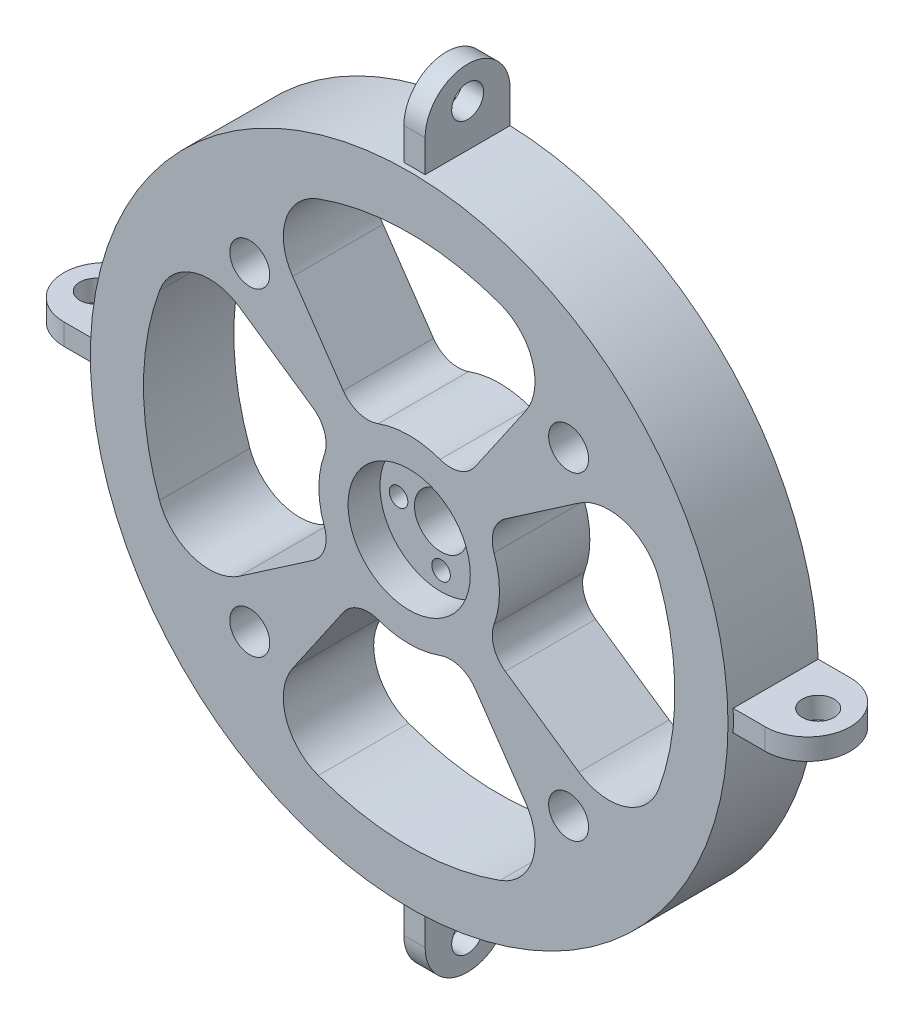
from build123d import *

# Parameters (mm, degrees)
SKETCH_1_R               = 60
EXTRUDE_1_DEPTH          = 17
SKETCH_2_R               = 3.76
CUT_EXTRUDE_1_DEPTH      = 87.539008545
EXTRUDE_2_DEPTH          = 2
SKETCH_4_R               = 3
CUT_EXTRUDE_7_DEPTH      = 99.025506885
CUT_EXTRUDE_3_REACH      = 98.773
SKETCH_5_R               = 5
SKETCH_6_R               = 11.5
CUT_EXTRUDE_4_DEPTH      = 6
CUT_EXTRUDE_5_REACH      = 97.901
SKETCH_7_R               = 1.75
CUT_EXTRUDE_6_REACH      = 98.773
PATTERN_CIRCULAR_3_COUNT = 4
PATTERN_CIRCULAR_4_COUNT = 4


with BuildPart() as part:
    # 草图1 → 凸台-拉伸1 (new body)
    with BuildSketch(Plane.XY):
        Circle(SKETCH_1_R)
    extrude(amount=EXTRUDE_1_DEPTH)

    # 草图2 → 切除-拉伸1 (cut, through all)
    with BuildSketch(Plane.XY.offset(17)):
        with Locations((-30, 30)):
            Circle(SKETCH_2_R)
        with Locations((30, 30)):
            Circle(SKETCH_2_R)
        with Locations((30, -30)):
            Circle(SKETCH_2_R)
        with Locations((-30, -30)):
            Circle(SKETCH_2_R)
    extrude(amount=-CUT_EXTRUDE_1_DEPTH, mode=Mode.SUBTRACT)

    # 草图3 → 凸台-拉伸2 (add, symmetric)
    with BuildSketch(Plane(origin=(0, 0, 0), x_dir=(0, 0, -1), z_dir=(1, 0, 0))):
        with BuildLine():
            Line((0, 58), (-16, 58))
            Line((-16, 58), (-16, 66))
            ThreePointArc((-16, 66), (-8, 74), (0, 66))
            Line((0, 66), (0, 58))
        make_face()
    extrude_2 = extrude(amount=EXTRUDE_2_DEPTH, both=True)

    # 草图4 → 切除-拉伸7 (cut, through all)
    with BuildSketch(Plane(origin=(2, 0, 0), x_dir=(0, 0, -1), z_dir=(1, 0, 0))):
        with Locations((-8, 67.966657402)):
            Circle(SKETCH_4_R)
    cut_extrude_7 = extrude(amount=-CUT_EXTRUDE_7_DEPTH, mode=Mode.SUBTRACT)

    # 草图5 → 切除-拉伸3 (cut, up to next)
    with BuildSketch(Plane(origin=(0, 0, 0), x_dir=(-1, 0, 0), z_dir=(0, 0, -1)), mode=Mode.PRIVATE) as cut_extrude_3_sk1:
        Circle(SKETCH_5_R)
    cut_extrude_3_tool1 = extrude(cut_extrude_3_sk1.sketch, amount=-CUT_EXTRUDE_3_REACH, mode=Mode.PRIVATE) & part.part
    add(cut_extrude_3_tool1.solids().sort_by_distance((0, 0, 0))[0], mode=Mode.SUBTRACT)

    # 草图6 → 切除-拉伸4 (cut)
    with BuildSketch(Plane.XY.offset(17)):
        Circle(SKETCH_6_R)
    extrude(amount=-CUT_EXTRUDE_4_DEPTH, mode=Mode.SUBTRACT)

    # 草图7 → 切除-拉伸5 (cut, up to next)
    with BuildSketch(Plane.XY.offset(11), mode=Mode.PRIVATE) as cut_extrude_5_sk1:
        with Locations((-8, 0)):
            Circle(SKETCH_7_R)
    cut_extrude_5_tool1 = extrude(cut_extrude_5_sk1.sketch, amount=-CUT_EXTRUDE_5_REACH, mode=Mode.PRIVATE) & part.part
    # 草图7 → 切除-拉伸5 (cut, up to next)
    with BuildSketch(Plane.XY.offset(11), mode=Mode.PRIVATE) as cut_extrude_5_sk2:
        with Locations((0, 8)):
            Circle(SKETCH_7_R)
    cut_extrude_5_tool2 = extrude(cut_extrude_5_sk2.sketch, amount=-CUT_EXTRUDE_5_REACH, mode=Mode.PRIVATE) & part.part
    # 草图7 → 切除-拉伸5 (cut, up to next)
    with BuildSketch(Plane.XY.offset(11), mode=Mode.PRIVATE) as cut_extrude_5_sk3:
        with Locations((8, 0)):
            Circle(SKETCH_7_R)
    cut_extrude_5_tool3 = extrude(cut_extrude_5_sk3.sketch, amount=-CUT_EXTRUDE_5_REACH, mode=Mode.PRIVATE) & part.part
    # 草图7 → 切除-拉伸5 (cut, up to next)
    with BuildSketch(Plane.XY.offset(11), mode=Mode.PRIVATE) as cut_extrude_5_sk4:
        with Locations((0, -8)):
            Circle(SKETCH_7_R)
    cut_extrude_5_tool4 = extrude(cut_extrude_5_sk4.sketch, amount=-CUT_EXTRUDE_5_REACH, mode=Mode.PRIVATE) & part.part
    add(cut_extrude_5_tool1.solids().sort_by_distance((-8, 0, 11))[0], mode=Mode.SUBTRACT)
    add(cut_extrude_5_tool2.solids().sort_by_distance((0, 8, 11))[0], mode=Mode.SUBTRACT)
    add(cut_extrude_5_tool3.solids().sort_by_distance((8, 0, 11))[0], mode=Mode.SUBTRACT)
    add(cut_extrude_5_tool4.solids().sort_by_distance((0, -8, 11))[0], mode=Mode.SUBTRACT)

    # 草图8 → 切除-拉伸6 (cut, up to next)
    with BuildSketch(Plane.XY.offset(17), mode=Mode.PRIVATE) as cut_extrude_6_sk1:
        with BuildLine():
            Line((-18.09189724, 12.423764363), (-31.926877482, 21.924290052))
            ThreePointArc((-31.926877482, 21.924290052), (-40.638216775, 23.204165271), (-46.984631039, 17.101007166))
            ThreePointArc((-46.984631039, 17.101007166), (-50, 0), (-46.984631039, -17.101007166))
            ThreePointArc((-46.984631039, -17.101007166), (-40.638216775, -23.204165271), (-31.926877482, -21.924290052))
            Line((-31.926877482, -21.924290052), (-18.09189724, -12.423764363))
            ThreePointArc((-18.09189724, -12.423764363), (-15.903129, -9.481080017), (-15.974774553, -5.814342437))
            ThreePointArc((-15.974774553, -5.814342437), (-17, 0), (-15.974774553, 5.814342437))
            ThreePointArc((-15.974774553, 5.814342437), (-15.903129, 9.481080017), (-18.09189724, 12.423764363))
        make_face()
    cut_extrude_6_tool1 = extrude(cut_extrude_6_sk1.sketch, amount=-CUT_EXTRUDE_6_REACH, mode=Mode.PRIVATE) & part.part
    cut_extrude_6 = cut_extrude_6_tool1.solids().sort_by_distance((-33.87223, 0, 17))[0]
    add(cut_extrude_6, mode=Mode.SUBTRACT)

    # 阵列(圆周)3: 切除-拉伸6 ×4 about axis
    pattern_circular_3_axis = Axis((0, 0, 17), (0, 0, 1))
    for i in range(1, PATTERN_CIRCULAR_3_COUNT):
        add(cut_extrude_6.rotate(pattern_circular_3_axis, i * 360 / PATTERN_CIRCULAR_3_COUNT), mode=Mode.SUBTRACT)

    # 阵列(圆周)4: 凸台-拉伸2, 切除-拉伸7 ×4 about axis
    pattern_circular_4_axis = Axis((0, 0, 17), (0, 0, 1))
    add([extrude_2.rotate(pattern_circular_4_axis, i * 360 / PATTERN_CIRCULAR_4_COUNT) for i in range(1, PATTERN_CIRCULAR_4_COUNT)])
    add([cut_extrude_7.rotate(pattern_circular_4_axis, i * 360 / PATTERN_CIRCULAR_4_COUNT) for i in range(1, PATTERN_CIRCULAR_4_COUNT)], mode=Mode.SUBTRACT)


solid = part.part
